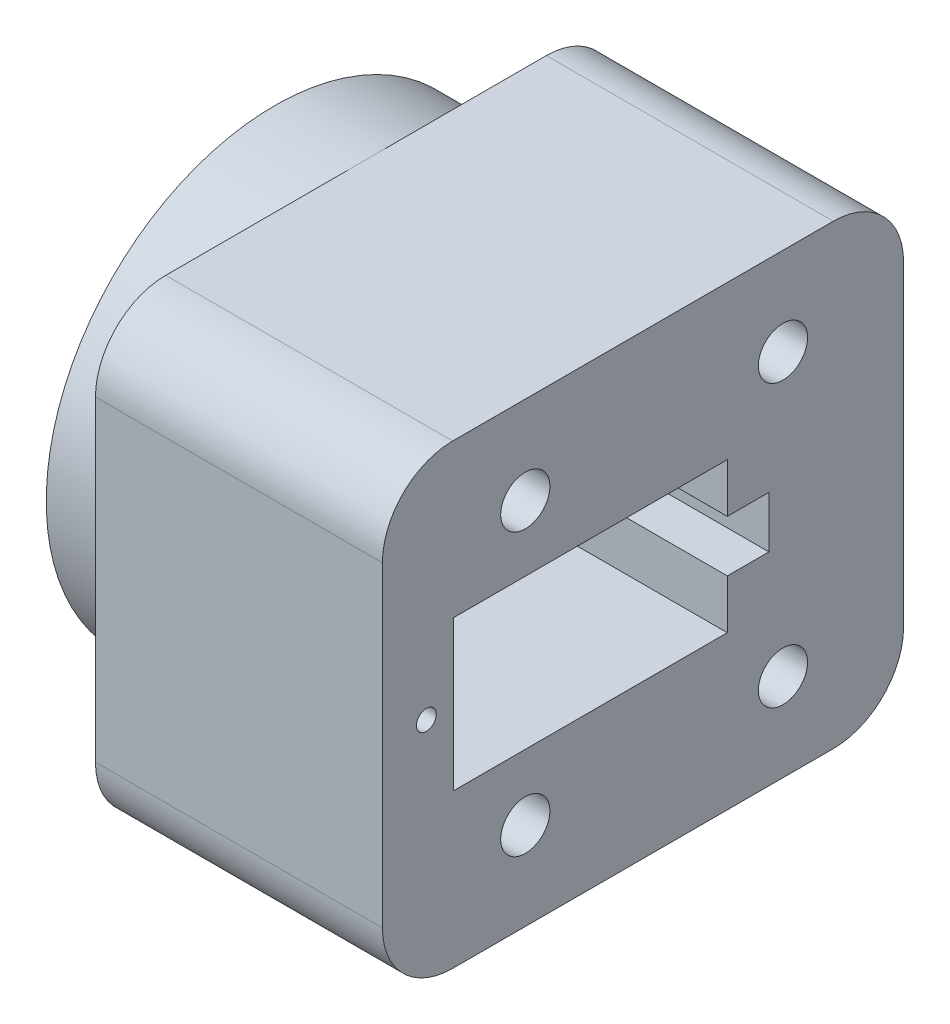
from build123d import *

# Parameters (mm, degrees)
SKETCH1_W           = 40.7
SKETCH1_H           = 17
BOSS_EXTRUDE1_DEPTH = 24.5
SKETCH2_W           = 40.7
SKETCH2_H           = 34
BOSS_EXTRUDE2_DEPTH = 4
SKETCH3_R           = 3.6
CUT_EXTRUDE1_DEPTH  = 4.4
CUT_EXTRUDE2_DEPTH  = 4.4
SKETCH5_R           = 1.2
CUT_EXTRUDE3_DEPTH  = 7
SKETCH6_W           = 23.4
SKETCH6_H           = 12.8
CUT_EXTRUDE4_DEPTH  = 19.2
SKETCH7_W           = 3.7
SKETCH7_H           = 4.4
CUT_EXTRUDE5_DEPTH  = 16
SKETCH8_R           = 0.85
CUT_EXTRUDE6_DEPTH  = 8.6
SKETCH9_R           = 1.7
CUT_EXTRUDE7_DEPTH  = 4.7
SKETCH10_W          = 5.5
SKETCH10_H          = 4.4
CUT_EXTRUDE8_DEPTH  = 8.3
BOSS_EXTRUDE3_DEPTH = 24.5
SKETCH12_W          = 5.5
SKETCH12_H          = 4.4
CUT_EXTRUDE9_DEPTH  = 3.5
CUT_EXTRUDE10_DEPTH = 326.708673511
SKETCH14_R          = 19.5
SKETCH14_R_2        = 18.3
BOSS_EXTRUDE4_DEPTH = 7.9
SKETCH15_R          = 2.1
CUT_EXTRUDE11_DEPTH = 6.1


with BuildPart() as part:
    # Sketch1 → Boss-Extrude1 (new body)
    with BuildSketch(Plane(origin=(169.4, 0, 0), x_dir=(0, 0, -1), z_dir=(1, 0, 0))):
        with Locations((-303.85, 0)):
            Rectangle(SKETCH1_W, SKETCH1_H)
    extrude(amount=BOSS_EXTRUDE1_DEPTH)

    # Sketch2 → Boss-Extrude2 (add)
    with BuildSketch(Plane(origin=(189.9, 0, 0), x_dir=(0, 0, -1), z_dir=(1, 0, 0))):
        with Locations((-303.85, 0)):
            Rectangle(SKETCH2_W, SKETCH2_H)
    extrude(amount=BOSS_EXTRUDE2_DEPTH)

    # Sketch3 → Cut-Extrude1 (cut)
    with BuildSketch(Plane(origin=(169.4, 0, 0), x_dir=(0, 0, -1), z_dir=(1, 0, 0))):
        with Locations((-301, 0)):
            Circle(SKETCH3_R)
    extrude(amount=CUT_EXTRUDE1_DEPTH, mode=Mode.SUBTRACT)

    # Sketch4 → Cut-Extrude2 (cut)
    with BuildSketch(Plane(origin=(169.4, 0, 0), x_dir=(0, 0, -1), z_dir=(1, 0, 0))):
        Polygon((-285.15, -1.95), (-301, -2.8), (-316.85, -1.95), (-316.85, 1.95), (-301, 2.8), (-285.15, 1.95), align=None)
    extrude(amount=CUT_EXTRUDE2_DEPTH, mode=Mode.SUBTRACT)

    # Sketch5 → Cut-Extrude3 (cut)
    with BuildSketch(Plane(origin=(169.4, 0, 0), x_dir=(0, 0, -1), z_dir=(1, 0, 0))):
        with Locations((-301, 0)):
            Circle(SKETCH5_R)
    extrude(amount=CUT_EXTRUDE3_DEPTH, mode=Mode.SUBTRACT)

    # Sketch6 → Cut-Extrude4 (cut)
    with BuildSketch(Plane(origin=(194.5, 0, 0), x_dir=(0, 0, -1), z_dir=(1, 0, 0))):
        with Locations((-306.45, 0)):
            Rectangle(SKETCH6_W, SKETCH6_H)
    extrude(amount=-CUT_EXTRUDE4_DEPTH, mode=Mode.SUBTRACT)

    # Sketch7 → Cut-Extrude5 (cut)
    with BuildSketch(Plane(origin=(194.5, 0, 0), x_dir=(0, 0, -1), z_dir=(1, 0, 0))):
        with Locations((-293.05, 0)):
            Rectangle(SKETCH7_W, SKETCH7_H)
    extrude(amount=-CUT_EXTRUDE5_DEPTH, mode=Mode.SUBTRACT)

    # Sketch8 → Cut-Extrude6 (cut)
    with BuildSketch(Plane(origin=(194.5, 0, 0), x_dir=(0, 0, -1), z_dir=(1, 0, 0))):
        with Locations((-320.45, 0)):
            Circle(SKETCH8_R)
    extrude(amount=-CUT_EXTRUDE6_DEPTH, mode=Mode.SUBTRACT)

    # Sketch9 → Cut-Extrude7 (cut)
    with BuildSketch(Plane(origin=(194.5, 0, 0), x_dir=(0, 0, -1), z_dir=(1, 0, 0))):
        with Locations((-290, 12)):
            Circle(SKETCH9_R)
        with Locations((-290, -12)):
            Circle(SKETCH9_R)
        with Locations((-312, 12)):
            Circle(SKETCH9_R)
        with Locations((-312, -12)):
            Circle(SKETCH9_R)
    extrude(amount=-CUT_EXTRUDE7_DEPTH, mode=Mode.SUBTRACT)

    # Sketch10 → Cut-Extrude8 (cut)
    with BuildSketch(Plane.XY.offset(283)):
        with Locations((181.25, 0)):
            Rectangle(SKETCH10_W, SKETCH10_H)
    extrude(amount=CUT_EXTRUDE8_DEPTH, mode=Mode.SUBTRACT)

    # Sketch11 → Boss-Extrude3 (add)
    with BuildSketch(Plane(origin=(169.4, 0, 0), x_dir=(0, 0, -1), z_dir=(1, 0, 0))):
        Polygon((-279.7, -19.5), (-324.2, -19.5), (-324.2, -8.5), (-283.5, -8.5), (-283.5, 8.5), (-324.2, 8.5), (-324.2, 19.5), (-279.7, 19.5), align=None)
    extrude(amount=BOSS_EXTRUDE3_DEPTH)

    # Sketch12 → Cut-Extrude9 (cut, symmetric)
    with BuildSketch(Plane.XY.offset(283)):
        with Locations((181.25, 0)):
            Rectangle(SKETCH12_W, SKETCH12_H)
    extrude(amount=CUT_EXTRUDE9_DEPTH, both=True, mode=Mode.SUBTRACT)

    # Sketch13 → Cut-Extrude10 (cut, through all)
    with BuildSketch(Plane(origin=(169.4, 0, 0), x_dir=(0, 0, -1), z_dir=(1, 0, 0))):
        with BuildLine():
            Line((-324.2, 13.5), (-325.5, 13.5))
            Line((-325.5, 13.5), (-325.5, 20.5))
            Line((-325.5, 20.5), (-318.2, 20.5))
            Line((-318.2, 20.5), (-318.2, 19.5))
            ThreePointArc((-318.2, 19.5), (-322.442640687, 17.742640687), (-324.2, 13.5))
        make_face()
        with BuildLine():
            Line((-324.2, -13.5), (-325.5, -13.5))
            Line((-325.5, -13.5), (-325.5, -20.5))
            Line((-325.5, -20.5), (-318.2, -20.5))
            Line((-318.2, -20.5), (-318.2, -19.5))
            ThreePointArc((-318.2, -19.5), (-322.442640687, -17.742640687), (-324.2, -13.5))
        make_face()
        with BuildLine():
            Line((-279.7, 13.5), (-278.4, 13.5))
            Line((-278.4, 13.5), (-278.4, 20.5))
            Line((-278.4, 20.5), (-285.7, 20.5))
            Line((-285.7, 20.5), (-285.7, 19.5))
            ThreePointArc((-285.7, 19.5), (-281.457359313, 17.742640687), (-279.7, 13.5))
        make_face()
        with BuildLine():
            Line((-279.7, -13.5), (-278.4, -13.5))
            Line((-278.4, -13.5), (-278.4, -20.5))
            Line((-278.4, -20.5), (-285.7, -20.5))
            Line((-285.7, -20.5), (-285.7, -19.5))
            ThreePointArc((-285.7, -19.5), (-281.457359313, -17.742640687), (-279.7, -13.5))
        make_face()
    extrude(amount=CUT_EXTRUDE10_DEPTH, mode=Mode.SUBTRACT)

    # Sketch14 → Boss-Extrude4 (add)
    with BuildSketch(Plane(origin=(169.4, 0, 0), x_dir=(0, 0, -1), z_dir=(1, 0, 0))):
        with Locations((-301, 0)):
            Circle(SKETCH14_R)
        with Locations((-301, 0)):
            Circle(SKETCH14_R_2, mode=Mode.SUBTRACT)
    extrude(amount=-BOSS_EXTRUDE4_DEPTH)

    # Sketch15 → Cut-Extrude11 (cut)
    with BuildSketch(Plane(origin=(194.5, 0, 0), x_dir=(0, 0, -1), z_dir=(1, 0, 0))):
        with Locations((-290, 12)):
            Circle(SKETCH15_R)
        with Locations((-290, -12)):
            Circle(SKETCH15_R)
        with Locations((-312, 12)):
            Circle(SKETCH15_R)
        with Locations((-312, -12)):
            Circle(SKETCH15_R)
    extrude(amount=-CUT_EXTRUDE11_DEPTH, mode=Mode.SUBTRACT)


solid = part.part
